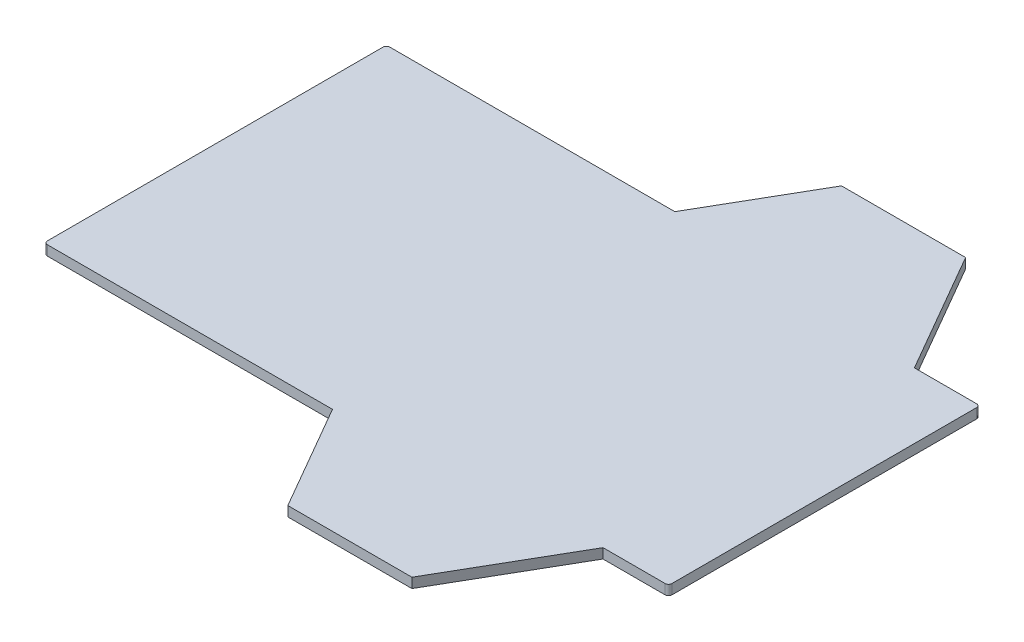
from build123d import *

# Parameters (mm, degrees)
BOSS_EXTRUDE1_DEPTH = 3
FILLET1_R           = 1


with BuildPart() as part:
    # Sketch1 → Boss-Extrude1 (new body)
    with BuildSketch(Plane(origin=(0, 0, 0), x_dir=(1, 0, 0), z_dir=(0, 1, 0))):
        Polygon((0, 52), (0, -52), (87.617056359, -52), (106.15, -84.1), (143.85, -84.1), (165.096489906, -47.3), (185, -47.3), (185, 47.3), (165.096489906, 47.3), (143.85, 84.1), (106.15, 84.1), (87.617056359, 52), align=None)
    extrude(amount=BOSS_EXTRUDE1_DEPTH)

    # Fillet1
    fillet1_edges = [part.edges().sort_by_distance(p)[0] for p in [
        (0, 1.5, 52),
        (0, 1.5, -52),
        (185, 1.5, -47.3),
        (185, 1.5, 47.3),
    ]]
    fillet(fillet1_edges, radius=FILLET1_R)


solid = part.part
